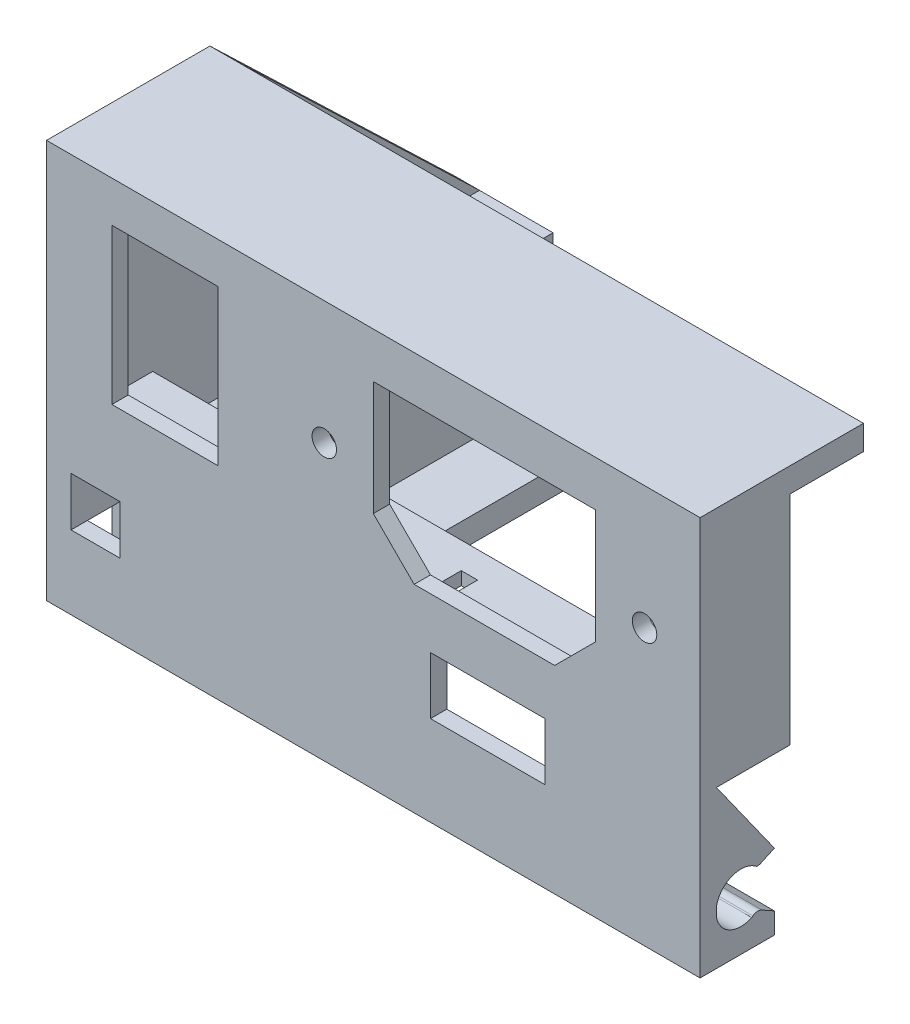
from build123d import *

# Parameters (mm, degrees)
RESSALTO_EXTRUS_O1_DEPTH      = 2
RESSALTO_EXTRUS_O1_DEPTH_BACK = 1
ESBO_O1_3_W                   = 35
ESBO_O1_3_H                   = 2
RESSALTO_EXTRUS_O2_DEPTH      = 8
RESSALTO_EXTRUS_O3_DEPTH      = 8
RESSALTO_EXTRUS_O5_START      = 8
ESBO_O1_5_W                   = 3
ESBO_O1_5_H                   = 50
ESBO_O1_5_W_2                 = 22
ESBO_O1_5_H_2                 = 6
RESSALTO_EXTRUS_O5_DEPTH      = 6.2
RESSALTO_EXTRUS_O6_START      = 14
ESBO_O1_6_W                   = 2
ESBO_O1_6_H                   = 6
ESBO_O1_6_H_2                 = 2
ESBO_O1_6_W_2                 = 22
ESBO_O1_6_W_3                 = 6
ESBO_O1_6_W_4                 = 3
ESBO_O1_6_H_3                 = 38
RESSALTO_EXTRUS_O6_DEPTH      = 5
ESBO_O5_R                     = 1.5
CORTE_EXTRUS_O2_DEPTH         = 10
RESSALTO_EXTRUS_O7_START      = -2
ESBO_O6_W                     = 13
ESBO_O6_H                     = 19
ESBO_O6_R                     = 1.5
ESBO_O6_W_2                   = 14
ESBO_O6_H_2                   = 7
RESSALTO_EXTRUS_O7_DEPTH      = 2
RESSALTO_EXTRUS_O8_START      = -10
ESBO_O6_3_W                   = 45
ESBO_O6_3_H                   = 0.8
RESSALTO_EXTRUS_O8_DEPTH      = 8
ESBO_O7_W                     = 2
ESBO_O7_H                     = 3.59531288
CORTE_EXTRUS_O3_DEPTH         = 10
ESBO_O11_W                    = 80
ESBO_O11_H                    = 3
RESSALTO_EXTRUS_O11_DEPTH     = 20
ESBO_O12_W                    = 3
ESBO_O12_H                    = 25
RESSALTO_EXTRUS_O12_DEPTH     = 18
RESSALTO_EXTRUS_O9_START      = -3
RESSALTO_EXTRUS_O9_DEPTH      = 3
ESBO_O10_W                    = 10
ESBO_O10_H                    = 25
RESSALTO_EXTRUS_O10_DEPTH     = 3
ESBO_O13_W                    = 4.849706681
ESBO_O13_H                    = 25
CORTE_EXTRUS_O4_DEPTH         = 10
RESSALTO_EXTRUS_O13_REACH     = 84.522
ESBO_O14_W                    = 1
ESBO_O14_H                    = 20.8
ESBO_O15_W                    = 1
ESBO_O15_H                    = 20
RESSALTO_EXTRUS_O14_DEPTH     = 39
ESBO_O20_W                    = 8
ESBO_O20_H                    = 10
RESSALTO_EXTRUS_O18_DEPTH     = 10
CORTE_EXTRUS_O6_START         = -10
ESBO_O21_R                    = 1.5
CORTE_EXTRUS_O6_DEPTH         = 10
RESSALTO_EXTRUS_O19_DEPTH     = 1
CORTE_EXTRUS_O7_DEPTH         = 4
RESSALTO_EXTRUS_O20_DEPTH     = 10
FILETE1_R                     = 1


with BuildPart() as part:
    # Esboço1 → Ressalto-extrusão1 (new, two sides: drawn at the far end of the back side and taken through both)
    with BuildSketch(Plane(origin=(0, 0, 0), x_dir=(1, 0, 0), z_dir=(0, 1, 0)).offset(-RESSALTO_EXTRUS_O1_DEPTH_BACK)):
        Polygon((0, 0), (0, 50), (20, 50), (20, 10), (35, 10), (35, 0), align=None)
    extrude(amount=RESSALTO_EXTRUS_O1_DEPTH + RESSALTO_EXTRUS_O1_DEPTH_BACK)

    # Esboço1<3> → Ressalto-extrusão2 (add)
    with BuildSketch(Plane(origin=(0, 0, 0), x_dir=(1, 0, 0), z_dir=(0, 1, 0))):
        with Locations((17.5, 1)):
            Rectangle(ESBO_O1_3_W, ESBO_O1_3_H)
        with Locations((17.5, 9)):
            Rectangle(ESBO_O1_3_W, ESBO_O1_3_H)
    extrude(amount=RESSALTO_EXTRUS_O2_DEPTH)

    # Esboço1<4> → Ressalto-extrusão3 (add)
    with BuildSketch(Plane(origin=(0, 0, 0), x_dir=(1, 0, 0), z_dir=(0, 1, 0))):
        Polygon((0, 10), (3, 10), (3, 48), (9, 48), (9, 10), (11, 10), (11, 50), (0, 50), align=None)
    extrude(amount=RESSALTO_EXTRUS_O3_DEPTH)

    # Esboço1<5> → Ressalto-extrusão5 (add)
    # profile 1 of 2: a face of its own
    with BuildSketch(Plane(origin=(0, 0, 0), x_dir=(1, 0, 0), z_dir=(0, 1, 0)).offset(RESSALTO_EXTRUS_O5_START)):
        with Locations((1.5, 25)):
            Rectangle(ESBO_O1_5_W, ESBO_O1_5_H)
    # profile 2 of 2: a face of its own
    with BuildSketch(Plane(origin=(0, 0, 0), x_dir=(1, 0, 0), z_dir=(0, 1, 0)).offset(RESSALTO_EXTRUS_O5_START)):
        Polygon((35, 0), (35, 10), (11, 10), (11, 50), (9, 50), (9, 0), align=None)
        with Locations((22, 5)):
            Rectangle(ESBO_O1_5_W_2, ESBO_O1_5_H_2, mode=Mode.SUBTRACT)
    extrude(amount=RESSALTO_EXTRUS_O5_DEPTH)

    # Esboço1<6> → Ressalto-extrusão6 (add)
    with BuildSketch(Plane(origin=(0, 0, 0), x_dir=(1, 0, 0), z_dir=(0, 1, 0)).offset(RESSALTO_EXTRUS_O6_START)):
        with Locations((34, 5)):
            Rectangle(ESBO_O1_6_W, ESBO_O1_6_H)
        with Locations((34, 1)):
            Rectangle(ESBO_O1_6_W, ESBO_O1_6_H_2)
        with Locations((22, 1)):
            Rectangle(ESBO_O1_6_W_2, ESBO_O1_6_H_2)
        with Locations((34, 9)):
            Rectangle(ESBO_O1_6_W, ESBO_O1_6_H_2)
        Polygon((11, 10), (11, 8), (33, 8), (33, 10), (20, 10), align=None)
        with Locations((10, 1)):
            Rectangle(ESBO_O1_6_W, ESBO_O1_6_H_2)
        with Locations((6, 1)):
            Rectangle(ESBO_O1_6_W_3, ESBO_O1_6_H_2)
        with Locations((1.5, 1)):
            Rectangle(ESBO_O1_6_W_4, ESBO_O1_6_H_2)
        with Locations((1.5, 5)):
            Rectangle(ESBO_O1_6_W_4, ESBO_O1_6_H)
        with Locations((1.5, 9)):
            Rectangle(ESBO_O1_6_W_4, ESBO_O1_6_H_2)
        with Locations((1.5, 29)):
            Rectangle(ESBO_O1_6_W_4, ESBO_O1_6_H_3)
        with Locations((1.5, 49)):
            Rectangle(ESBO_O1_6_W_4, ESBO_O1_6_H_2)
        with Locations((6, 9)):
            Rectangle(ESBO_O1_6_W_3, ESBO_O1_6_H_2)
        with Locations((10, 9)):
            Rectangle(ESBO_O1_6_W, ESBO_O1_6_H_2)
        with Locations((6, 49)):
            Rectangle(ESBO_O1_6_W_3, ESBO_O1_6_H_2)
        with Locations((10, 49)):
            Rectangle(ESBO_O1_6_W, ESBO_O1_6_H_2)
        with Locations((10, 29)):
            Rectangle(ESBO_O1_6_W, ESBO_O1_6_H_3)
    extrude(amount=RESSALTO_EXTRUS_O6_DEPTH)

    # Esboço5 → Corte-extrusão2 (cut)
    with BuildSketch(Plane(origin=(0, 2, 0), x_dir=(1, 0, 0), z_dir=(0, 1, 0))):
        with Locations(Location((16, 15, 0), (0, 0, 270))):
            Circle(ESBO_O5_R)
        with Locations(Location((16, 45, 0), (0, 0, 270))):
            Circle(ESBO_O5_R)
    extrude(amount=-CORTE_EXTRUS_O2_DEPTH, mode=Mode.SUBTRACT)

    # Esboço6 → Ressalto-extrusão7 (add)
    with BuildSketch(Plane.XY.offset(RESSALTO_EXTRUS_O7_START)):
        Polygon((80, 44.8), (0, 44.8), (0, 19), (35, 19), (35, -1), (80, -1), align=None)
        with Locations((14.5, 33.3)):
            Rectangle(ESBO_O6_W, ESBO_O6_H, mode=Mode.SUBTRACT)
        with Locations((34, 32.731591612)):
            Circle(ESBO_O6_R, mode=Mode.SUBTRACT)
        Polygon((45, 23.231591612), (40, 28.231591612), (40, 42.231591612), (67.2, 42.231591612), (67.2, 28.231591612), (62.2, 23.231591612), align=None, mode=Mode.SUBTRACT)
        with Locations((73.2, 32.731591612)):
            Circle(ESBO_O6_R, mode=Mode.SUBTRACT)
        with Locations((54, 13.5)):
            Rectangle(ESBO_O6_W_2, ESBO_O6_H_2, mode=Mode.SUBTRACT)
    extrude(amount=RESSALTO_EXTRUS_O7_DEPTH)

    # Esboço6<3> → Ressalto-extrusão8 (add)
    with BuildSketch(Plane.XY.offset(RESSALTO_EXTRUS_O8_START)):
        Polygon((80, 19.8), (0, 19.8), (0, 19), (35, 19), (80, 19), align=None)
        with Locations((57.5, 18.6)):
            Rectangle(ESBO_O6_3_W, ESBO_O6_3_H)
    extrude(amount=RESSALTO_EXTRUS_O8_DEPTH)

    # Esboço7 → Corte-extrusão3 (cut)
    with BuildSketch(Plane(origin=(0, 19.8, 0), x_dir=(1, 0, 0), z_dir=(0, 1, 0))):
        with Locations((44, 5.971535205)):
            Rectangle(ESBO_O7_W, ESBO_O7_H)
        with Locations((64, 5.971535205)):
            Rectangle(ESBO_O7_W, ESBO_O7_H)
    extrude(amount=-CORTE_EXTRUS_O3_DEPTH, mode=Mode.SUBTRACT)

    # Esboço11 → Ressalto-extrusão11 (add)
    with BuildSketch(Plane.XY):
        with Locations((40, 46.3)):
            Rectangle(ESBO_O11_W, ESBO_O11_H)
    extrude(amount=-RESSALTO_EXTRUS_O11_DEPTH)

    # Esboço12 → Ressalto-extrusão12 (add)
    with BuildSketch(Plane(origin=(0, 0, -2), x_dir=(-1, 0, 0), z_dir=(0, 0, -1))):
        with Locations((-26.5, 32.3)):
            Rectangle(ESBO_O12_W, ESBO_O12_H)
    extrude(amount=RESSALTO_EXTRUS_O12_DEPTH)

    # Esboço9 → Ressalto-extrusão9 (add)
    with BuildSketch(Plane.ZY.offset(RESSALTO_EXTRUS_O9_START)):
        Polygon((-20, 47.8), (-50, 19), (-2, 19), (-2, 47.8), align=None)
    extrude(amount=RESSALTO_EXTRUS_O9_DEPTH)

    # Esboço10 → Ressalto-extrusão10 (add)
    with BuildSketch(Plane(origin=(80, 0, 0), x_dir=(0, 0, -1), z_dir=(1, 0, 0))):
        with Locations((5, 32.3)):
            Rectangle(ESBO_O10_W, ESBO_O10_H)
    extrude(amount=-RESSALTO_EXTRUS_O10_DEPTH)

    # Esboço13 → Corte-extrusão4 (cut)
    with BuildSketch(Plane(origin=(28, 0, 0), x_dir=(0, 0, -1), z_dir=(1, 0, 0))):
        with Locations((22.424853341, 32.3)):
            Rectangle(ESBO_O13_W, ESBO_O13_H)
        Polygon((10, 19.8), (20, 44.8), (20, 19.8), align=None)
    extrude(amount=-CORTE_EXTRUS_O4_DEPTH, mode=Mode.SUBTRACT)

    # Ressalto-extrusão13: up to this face of the body (flat: up to its plane)
    ressalto_extrus_o13_end = Plane(part.part.faces().sort_by_distance((11, 10.5, -30))[0])
    # Esboço14 → Ressalto-extrusão13 (add, up to the picked face)
    with BuildSketch(Plane(origin=(35, 0, 0), x_dir=(0, 0, -1), z_dir=(1, 0, 0)), mode=Mode.PRIVATE) as ressalto_extrus_o13_sk1:
        with Locations((10.5, 9.4)):
            Rectangle(ESBO_O14_W, ESBO_O14_H)
    ressalto_extrus_o13_tool1 = split(extrude(ressalto_extrus_o13_sk1.sketch, amount=-RESSALTO_EXTRUS_O13_REACH, mode=Mode.PRIVATE), bisect_by=ressalto_extrus_o13_end, keep=Keep.BOTH, mode=Mode.PRIVATE)
    add(ressalto_extrus_o13_tool1.solids().sort_by(Axis((35, 9.4, -10.5), (-1, 0, 0)))[0])

    # Esboço15 → Ressalto-extrusão14 (add)
    with BuildSketch(Plane(origin=(0, 0, -50), x_dir=(-1, 0, 0), z_dir=(0, 0, -1))):
        with Locations((-11.5, 9)):
            Rectangle(ESBO_O15_W, ESBO_O15_H)
    extrude(amount=-RESSALTO_EXTRUS_O14_DEPTH)

    # Esboço20 → Ressalto-extrusão18 (add)
    with BuildSketch(Plane(origin=(0, 2, 0), x_dir=(1, 0, 0), z_dir=(0, 1, 0))):
        with Locations((16, 16)):
            Rectangle(ESBO_O20_W, ESBO_O20_H)
    extrude(amount=RESSALTO_EXTRUS_O18_DEPTH)

    # Esboço21 → Corte-extrusão6 (cut)
    with BuildSketch(Plane.XZ.offset(-2).offset(CORTE_EXTRUS_O6_START)):
        with Locations(Location((16, -15, 0), (0, 0, 270))):
            Circle(ESBO_O21_R)
    extrude(amount=CORTE_EXTRUS_O6_DEPTH, mode=Mode.SUBTRACT)

    # Esboço22 → Ressalto-extrusão19 (add)
    with BuildSketch(Plane(origin=(0, 0, -10), x_dir=(-1, 0, 0), z_dir=(0, 0, -1))):
        Polygon((-35, 18.2), (-35, 19.8), (-77, 19.8), (-77, 44.8), (-80, 44.8), (-80, 18.2), align=None)
    extrude(amount=RESSALTO_EXTRUS_O19_DEPTH)

    # Esboço23 → Corte-extrusão7 (cut)
    with BuildSketch(Plane(origin=(0, 12, 0), x_dir=(1, 0, 0), z_dir=(0, 1, 0))):
        Polygon((18.75, 16.58771324), (16, 18.175426481), (13.25, 16.58771324), (13.25, 13.41228676), (16, 11.824573519), (18.75, 13.41228676), align=None)
        Polygon((18.75, 43.41228676), (18.75, 46.58771324), (16, 48.175426481), (13.25, 46.58771324), (13.25, 43.41228676), (16, 41.824573519), align=None)
    extrude(amount=-CORTE_EXTRUS_O7_DEPTH, mode=Mode.SUBTRACT)

    # Esboço24 → Ressalto-extrusão20 (add)
    with BuildSketch(Plane(origin=(80, 0, 0), x_dir=(0, 0, -1), z_dir=(1, 0, 0))):
        with BuildLine():
            Line((9.100514075, 8.213270058), (2, 18.2))
            Line((2, 18.2), (2, 5.55))
            ThreePointArc((2, 5.55), (3.951321001, 7.864048246), (6.935535628, 7.357159696))
            Line((6.935535628, 7.357159696), (6.984313483, 7.25))
            Line((6.984313483, 7.25), (9.100514075, 8.213270058))
        make_face()
        with BuildLine():
            Line((2, 4.45), (2, -1))
            Line((2, -1), (9.100514075, -1))
            Line((9.100514075, -1), (9.100514075, 1.559444743))
            Line((9.100514075, 1.559444743), (6.984313483, 2.75))
            Line((6.984313483, 2.75), (6.320880397, 2.25085923))
            ThreePointArc((6.320880397, 2.25085923), (3.616556582, 2.281804954), (2, 4.45))
        make_face()
    extrude(amount=-RESSALTO_EXTRUS_O20_DEPTH)

    # Filete1
    # the kernel refuses this fillet: 1 mm, written as the material it takes off along each edge
    with BuildSketch(Plane(origin=(81.633402331, 2.75, -6.984313483), x_dir=(0, -0.4903214392898115, -0.8715416720804391), z_dir=(-1, 0, 0))) as filete1_piece_1:
        with BuildLine():
            CenterArc((FILETE1_R * 0.653360932246, FILETE1_R), FILETE1_R, 203.681935757, 66.318064243)
            Line((-FILETE1_R * 0.262428341882, FILETE1_R * 0.598340933885), (-FILETE1_R * 0.280744127364, FILETE1_R * 0.590307752563))
            Line((-FILETE1_R * 0.280744127364, FILETE1_R * 0.590307752563), (-FILETE1_R * 0.0130672186449, -FILETE1_R * 0.02))
            Line((-FILETE1_R * 0.0130672186449, -FILETE1_R * 0.02), (FILETE1_R * 0.653360932246, -FILETE1_R * 0.02))
            Line((FILETE1_R * 0.653360932246, -FILETE1_R * 0.02), (FILETE1_R * 0.653360932246, 0))
        make_face()
    extrude(amount=13.266804661, mode=Mode.SUBTRACT)
    with BuildSketch(Plane(origin=(81.176901612, 7.25, -6.984313483), x_dir=(0, 0.910145890185138, 0.4142878933532846), z_dir=(-1, 0, 0))) as filete1_piece_2:
        with BuildLine():
            CenterArc((1, 0.470760645), FILETE1_R, 180, 28.083682979)
            Line((0, 0.470760645), (-0.02, 0.470760645))
            Line((-0.02, 0.470760645), (-0.02, 0))
            Line((-0.02, 0), (0, -0.02))
            ThreePointArc((0, -0.02), (0.058869516, -0.02), (0.100093813, -0.009415213))
            Line((0.100093813, -0.009415213), (0.117739032, 0))
        make_face()
    extrude(amount=12.353803225, mode=Mode.SUBTRACT)


solid = part.part
